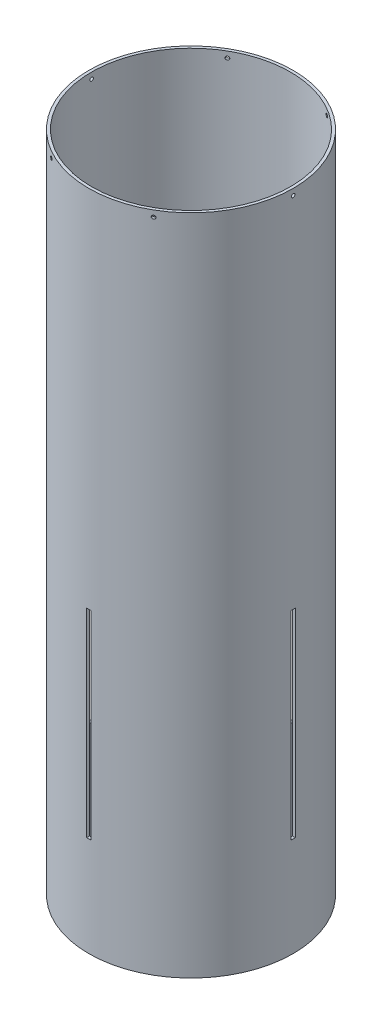
from build123d import *

# Parameters (mm, degrees)
SKETCH1_R           = 78.359
SKETCH1_R_2         = 76.2
BOSS_EXTRUDE1_DEPTH = 508
CUT_EXTRUDE1_DEPTH  = 520.946406625
CIRPATTERN1_COUNT   = 4
CUT_EXTRUDE2_DEPTH  = 520.946406625
CIRPATTERN2_COUNT   = 6
SKETCH3_R           = 3.175
CUT_EXTRUDE3_DEPTH  = 520.946406753


with BuildPart() as part:
    # Sketch1 → Boss-Extrude1 (new body)
    with BuildSketch(Plane(origin=(0, 0, 0), x_dir=(1, 0, 0), z_dir=(0, 1, 0))):
        Circle(SKETCH1_R)
        Circle(SKETCH1_R_2, mode=Mode.SUBTRACT)
    extrude(amount=BOSS_EXTRUDE1_DEPTH)

    # Sketch2 → Cut-Extrude1 (cut, through all)
    with BuildSketch(Plane(origin=(0, 0, 0), x_dir=(0, 0, -1), z_dir=(1, 0, 0))):
        Polygon((0, 76.2), (1.5875, 76.2), (1.5875, 228.6), (-1.5875, 228.6), (-1.5875, 76.2), align=None)
    cut_extrude1 = extrude(amount=-CUT_EXTRUDE1_DEPTH, mode=Mode.SUBTRACT)

    # CirPattern1: Cut-Extrude1 ×4 about axis
    cirpattern1_axis = Axis((0, 0, 0), (0, 1, 0))
    for i in range(1, CIRPATTERN1_COUNT):
        add(cut_extrude1.rotate(cirpattern1_axis, i * 360 / CIRPATTERN1_COUNT), mode=Mode.SUBTRACT)

    # Sketch2<3> → Cut-Extrude2 (cut, through all)
    with BuildSketch(Plane(origin=(0, 0, 0), x_dir=(0, 0, -1), z_dir=(1, 0, 0))):
        with BuildLine():
            ThreePointArc((0, 504.59005), (-0.956397277, 502.281102723), (1.35255, 503.2375))
            ThreePointArc((1.35255, 503.2375), (0.956397277, 504.193897277), (0, 504.59005))
        make_face()
    cut_extrude2 = extrude(amount=-CUT_EXTRUDE2_DEPTH, mode=Mode.SUBTRACT)

    # CirPattern2: Cut-Extrude2 ×6 about axis
    cirpattern2_axis = Axis((0, 508, 0), (0, -1, 0))
    for i in range(1, CIRPATTERN2_COUNT):
        add(cut_extrude2.rotate(cirpattern2_axis, i * 360 / CIRPATTERN2_COUNT), mode=Mode.SUBTRACT)

    # Sketch3 → Cut-Extrude3 (cut, through all)
    with BuildSketch(Plane(origin=(0, 0, 0), x_dir=(0.7071067811865477, 0, -0.7071067811865475), z_dir=(0.7071067811865475, 0, 0.7071067811865477))):
        with Locations((0, 127)):
            Circle(SKETCH3_R)
    extrude(amount=-CUT_EXTRUDE3_DEPTH, mode=Mode.SUBTRACT)


solid = part.part
